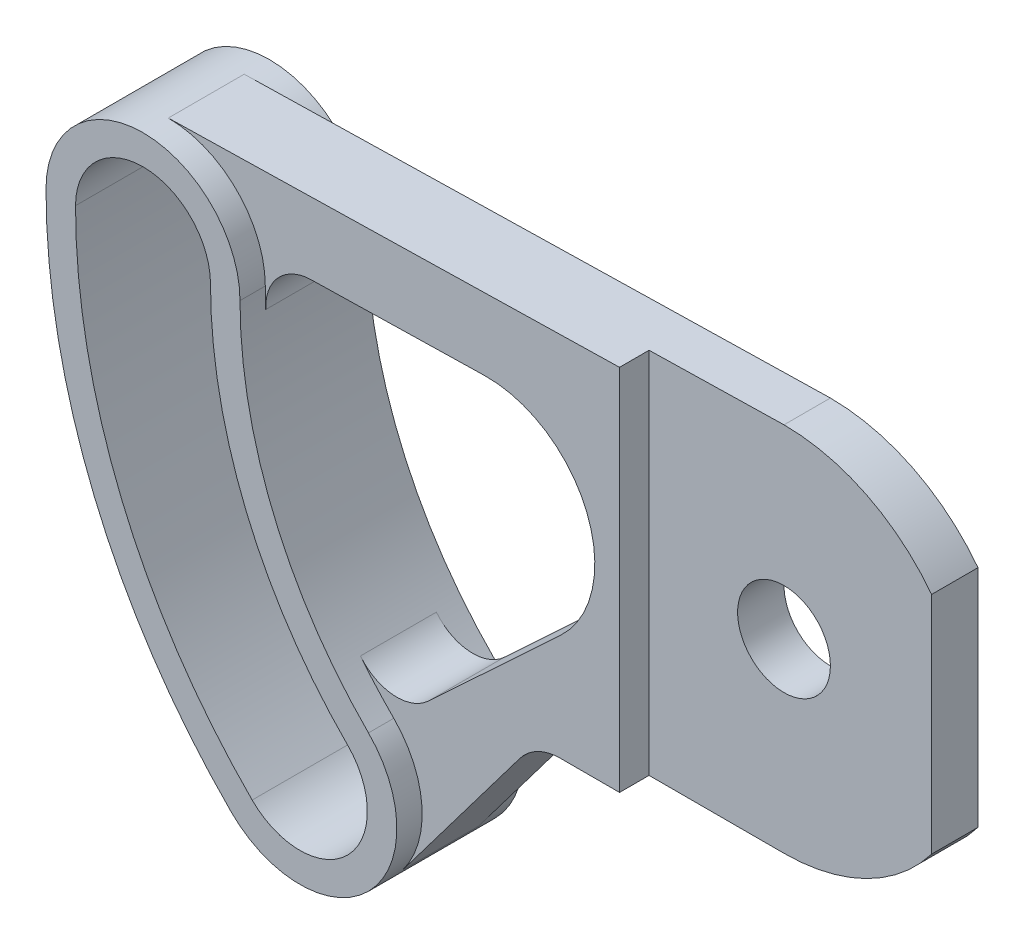
from build123d import *

# Parameters (mm, degrees)
BOSS_EXTRUDE1_DEPTH = 15
SKETCH1_3_R         = 11
BOSS_EXTRUDE2_DEPTH = 9
CUT_EXTRUDE1_START  = 2
SKETCH1_5_R         = 11
CUT_EXTRUDE1_DEPTH  = 7
FILLET1_R           = 11


with BuildPart() as part:
    # Sketch1 → Boss-Extrude1 (new, symmetric)
    with BuildSketch(Plane.XY):
        with BuildLine():
            ThreePointArc((-162, 18), (-150.581929877, -39.402514855), (-118.066017178, -88.066017178))
            ThreePointArc((-118.066017178, -88.066017178), (-85.539105243, -88.066017178), (-85.539105243, -55.539105243))
            ThreePointArc((-85.539105243, -55.539105243), (-108.083471381, -21.799076966), (-116, 18))
            ThreePointArc((-116, 18), (-139, 41), (-162, 18))
        make_face()
        with BuildLine():
            ThreePointArc((-123, 18), (-139, 34), (-155, 18))
            ThreePointArc((-155, 18), (-144.114773149, -36.723730828), (-113.11626971, -83.11626971))
            ThreePointArc((-113.11626971, -83.11626971), (-90.488852712, -83.11626971), (-90.488852712, -60.488852712))
            ThreePointArc((-90.488852712, -60.488852712), (-114.550628109, -24.477860993), (-123, 18))
        make_face(mode=Mode.SUBTRACT)
    extrude(amount=BOSS_EXTRUDE1_DEPTH, both=True)

    # Sketch1<3> → Boss-Extrude2 (add, symmetric)
    with BuildSketch(Plane.XY):
        with BuildLine():
            ThreePointArc((0, -44), (19.528931575, -39.428680317), (35, -26.664583252))
            Line((35, -26.664583252), (35, 26.664583252))
            ThreePointArc((35, 26.664583252), (19.528931575, 39.428680317), (0, 44))
            Line((0, 44), (-139, 41))
            ThreePointArc((-139, 41), (-125.21351497, 36.410128476), (-116.929481683, 24.472420045))
            Line((-116.929481683, 24.472420045), (-64.032905328, 25.614072772))
            ThreePointArc((-64.032905328, 25.614072772), (-51.356216469, 22.569851157), (-41.818901123, 13.681356252))
            ThreePointArc((-41.818901123, 13.681356252), (-38.072611256, -3.293430459), (-46.023062445, -18.752033163))
            Line((-46.023062445, -18.752033163), (-85.539105243, -55.539105243))
            ThreePointArc((-85.539105243, -55.539105243), (-78.857942833, -70.207416226), (-83.445115781, -85.659119128))
            Line((-83.445115781, -85.659119128), (-55.600860061, -48.770491521))
            ThreePointArc((-55.600860061, -48.770491521), (-51.37310442, -45.258629004), (-46.023062445, -44))
            Line((-46.023062445, -44), (0, -44))
        make_face()
        Circle(SKETCH1_3_R, mode=Mode.SUBTRACT)
    extrude(amount=BOSS_EXTRUDE2_DEPTH, both=True)

    # Sketch1<5> → Cut-Extrude1 (cut)
    # profile 1 of 2: a face of its own
    with BuildSketch(Plane.XY.offset(CUT_EXTRUDE1_START)):
        with BuildLine():
            ThreePointArc((-32, 30.199337741), (-18.292282048, 40.017401433), (-1.898396275, 43.959027419))
            Line((-1.898396275, 43.959027419), (-32, 43.309352518))
            Line((-32, 43.309352518), (-32, 30.199337741))
        make_face()
    # profile 2 of 2: a face of its own
    with BuildSketch(Plane.XY.offset(CUT_EXTRUDE1_START)):
        with BuildLine():
            ThreePointArc((0, -44), (19.528931575, -39.428680317), (35, -26.664583252))
            Line((35, -26.664583252), (35, 26.664583252))
            ThreePointArc((35, 26.664583252), (19.528931575, 39.428680317), (0, 44))
            Line((0, 44), (-1.898396275, 43.959027419))
            ThreePointArc((-1.898396275, 43.959027419), (-18.292282048, 40.017401433), (-32, 30.199337741))
            Line((-32, 30.199337741), (-32, -44))
            Line((-32, -44), (0, -44))
        make_face()
        Circle(SKETCH1_5_R, mode=Mode.SUBTRACT)
    extrude(amount=CUT_EXTRUDE1_DEPTH, mode=Mode.SUBTRACT)

    # Fillet1
    # the kernel refuses this fillet: 11 mm, written as the material it adds along each edge
    with BuildSketch(Plane(origin=(-116.929481683, 24.472420045, -9), x_dir=(0.09199621830017597, -0.9957593563800776, 0), z_dir=(0, 0, 1))) as fillet1_piece_1:
        with BuildLine():
            CenterArc((11.803908742, 10.988267546), FILLET1_R, 175.957949098, 91.395536091)
            Line((0.831270302, 11.763642077), (-0.265993542, 11.841179531))
            Line((-0.265993542, 11.841179531), (-1.097263844, 0.077537453))
            Line((-1.097263844, 0.077537453), (0.211131542, -1.079547809))
            ThreePointArc((0.211131542, -1.079547809), (6.429285778, -0.765233377), (11.245203657, -1.098826755))
            Line((11.245203657, -1.098826755), (11.295995028, 0))
        make_face()
    extrude(amount=18)
    with BuildSketch(Plane(origin=(-85.539105243, -55.539105243, 9), x_dir=(-0.6656229330882777, 0.7462882224361834, 0), z_dir=(0, 0, -1))) as fillet1_piece_2:
        with BuildLine():
            CenterArc((11.236677702, 10.982091478), FILLET1_R, 178.778435739, 94.49143138)
            Line((0.239177665, 11.216597213), (0, 0))
            ThreePointArc((0, 0), (5.932053203, -0.16931694), (11.864106406, 0))
        make_face()
    extrude(amount=18)


solid = part.part
